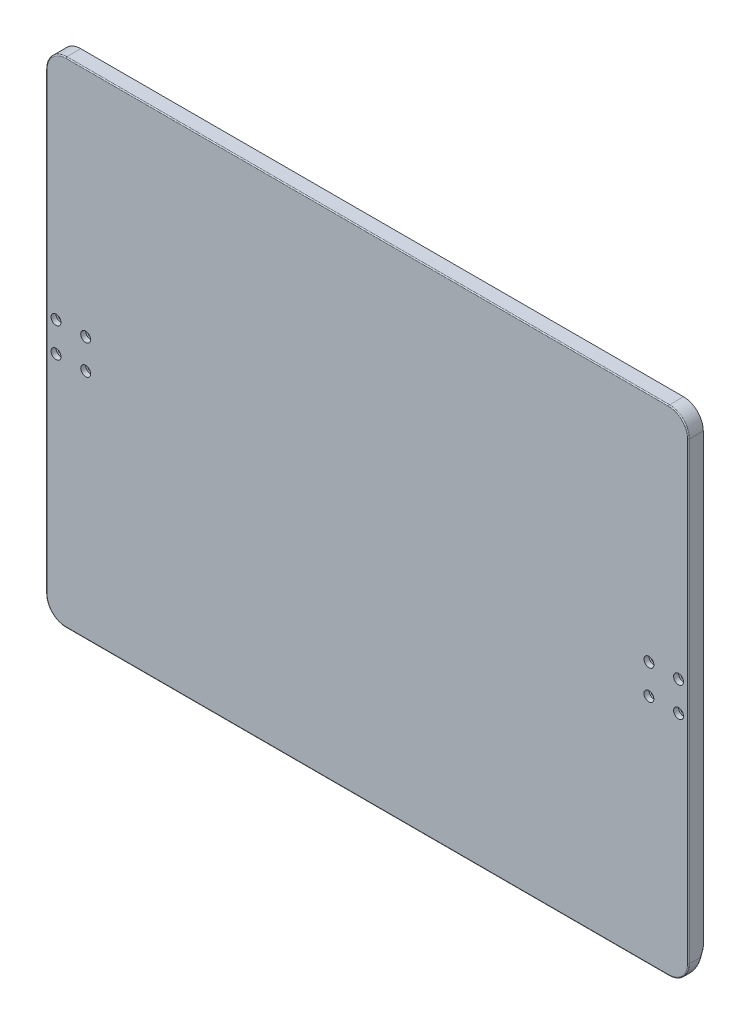
from build123d import *

# Parameters (mm, degrees)
SKETCH1_W                              = 650
SKETCH1_H                              = 500
BASE_DEPTH                             = 15
COUNTERBORED_M5_BOLT_HOLES_D           = 5.5
COUNTERBORED_M5_BOLT_HOLES_CBORE_D     = 10
COUNTERBORED_M5_BOLT_HOLES_CBORE_DEPTH = 5
ROUND_CORNERS_R                        = 20
BREAK_TOP_EDGE_R                       = 1
CHAMFER2_SIZE                          = 9.099255857
CHAMFER2_SIZE_2                        = 25
FILLET3_R                              = 1


with BuildPart() as part:
    # Sketch1 → base (new body)
    with BuildSketch(Plane.XY):
        with Locations((325, 250)):
            Rectangle(SKETCH1_W, SKETCH1_H)
    extrude(amount=BASE_DEPTH)

    # counterbored M5 bolt holes (through all)
    with Locations(Plane.XY.offset(15)):
        with Locations((10, 265), (40, 235), (10, 235), (40, 265)):
            counterbored_m5_bolt_holes = CounterBoreHole(COUNTERBORED_M5_BOLT_HOLES_D / 2, COUNTERBORED_M5_BOLT_HOLES_CBORE_D / 2, COUNTERBORED_M5_BOLT_HOLES_CBORE_DEPTH)

    # mirror counterbored bolt holes: counterbored M5 bolt holes across plane
    add(counterbored_m5_bolt_holes.mirror(Plane.ZY.offset(-325)), mode=Mode.SUBTRACT)

    # round corners
    round_corners_edges = [part.edges().sort_by_distance(p)[0] for p in [
        (0, 500, 7.5),
        (650, 500, 7.5),
        (650, 0, 7.5),
        (0, 0, 7.5),
    ]]
    fillet(round_corners_edges, radius=ROUND_CORNERS_R)

    # break top edge
    break_top_edge_edges = [part.edges().sort_by_distance(p)[0] for p in [
        (0, 250, 15),
        (325, 500, 15),
        (325, 0, 15),
        (650, 250, 15),
        (5.857864376, 5.857864376, 15),
        (644.142135624, 5.857864376, 15),
        (644.142135624, 494.142135624, 15),
        (5.857864376, 494.142135624, 15),
    ]]
    fillet(break_top_edge_edges, radius=BREAK_TOP_EDGE_R)

    # Chamfer2
    # the kernel refuses this chamfer: 25, 9.099255857 mm, written as the material it takes off along each edge
    with BuildSketch(Plane(origin=(-44.854868314, 0, 0), x_dir=(0, -0.09904090225204935, 0.9950833631817486), z_dir=(1, 0, 0))) as chamfer2_piece_1:
        Polygon((CHAMFER2_SIZE * 0.995083363144, -CHAMFER2_SIZE * 0.0990409022483), (-CHAMFER2_SIZE_2 * 0.099040902252, -CHAMFER2_SIZE_2 * 0.995083363182), (0, 0), align=None)
    extrude(amount=739.709736628, mode=Mode.SUBTRACT)

    # Fillet3
    fillet3_edges = [part.edges().sort_by_distance(p)[0] for p in [
        (325, 0, 9.099255857),
        (644.360022397, 6.079161061, 6.886622181),
        (650, 22.5, 0.909925586),
        (325, 25, 0),
        (0, 22.5, 0.909925586),
        (5.639977603, 6.079161061, 6.886622181),
    ]]
    fillet(fillet3_edges, radius=FILLET3_R)


solid = part.part
